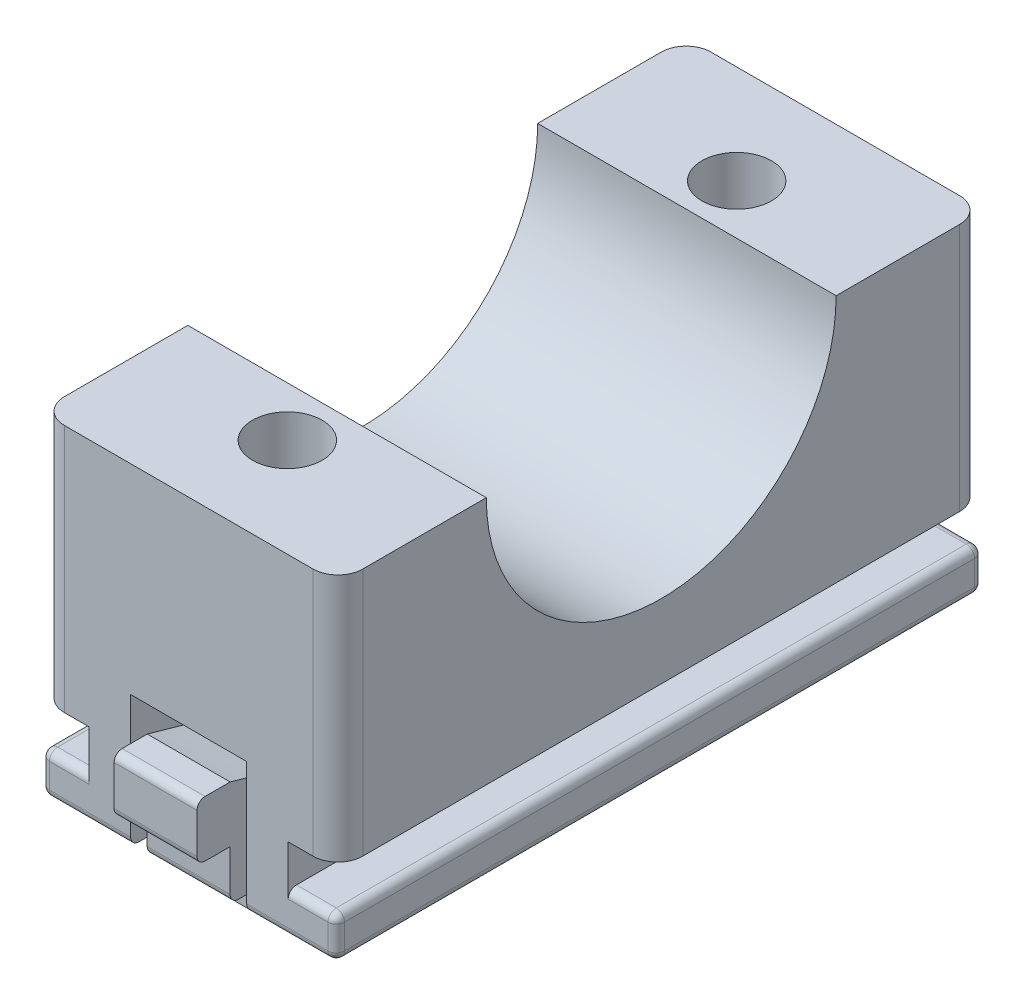
from build123d import *

# Parameters (mm, degrees)
BOSS_EXTRUDE1_DEPTH             = 39
HANDLEBARHOLE_R                 = 10.55
CUT_EXTRUDE1_DEPTH              = 48.381430962
SKETCH3_R                       = 2.1
CUT_EXTRUDE2_DEPTH              = 14
BOSS_EXTRUDE2_DEPTH             = 2.5
BOSS_EXTRUDE2_DEPTH_BACK        = 2.5
FILLET1_R                       = 0.5
CUT_EXTRUDE_THIN2_START         = -3.5
CUT_EXTRUDE_THIN2_DEPTH         = 7
CUT_EXTRUDE5_REACH              = 49.381
SKETCH10_W                      = 1
SKETCH10_H                      = 25.953669743
BOSS_EXTRUDE3_REACH             = 46.744
BOSS_EXTRUDE3_DIRECTION_2_REACH = 46.744
FILLET5_R                       = 1.5


# Read off the part's stored shape, not the designer's step: Cut-Extrude-Thin2
with BuildPart() as part:
    # Sketch1 → Boss-Extrude1 (new body)
    with BuildSketch(Plane.XY):
        Polygon((0, 5), (0, 20), (18, 20), (18, 5), (15, 5), (15, 2.5), (17.9, 2.5), (17.9, 0), (0.1, 0), (0.1, 2.5), (3, 2.5), (3, 5), align=None)
    extrude(amount=BOSS_EXTRUDE1_DEPTH)

    # HandlebarHole → Cut-Extrude1 (cut, through all)
    with BuildSketch(Plane(origin=(0, 0, 0), x_dir=(0, 0, -1), z_dir=(1, 0, 0))):
        with Locations((-19.5, 20)):
            Circle(HANDLEBARHOLE_R)
    extrude(amount=CUT_EXTRUDE1_DEPTH, mode=Mode.SUBTRACT)

    # Sketch3 → Cut-Extrude2 (cut)
    with BuildSketch(Plane(origin=(0, 20, 0), x_dir=(1, 0, 0), z_dir=(0, 1, 0))):
        with Locations(Location((9, -5.95, 0), (0, 0, 270))):
            Circle(SKETCH3_R)
        with Locations(Location((9, -33.05, 0), (0, 0, 270))):
            Circle(SKETCH3_R)
    extrude(amount=-CUT_EXTRUDE2_DEPTH, mode=Mode.SUBTRACT)

    # Sketch4 → Boss-Extrude2 (add, two sides: drawn at the far end of the back side and taken through both)
    with BuildSketch(Plane.ZY.offset(-9).offset(-BOSS_EXTRUDE2_DEPTH_BACK)):
        Polygon((33.5, 0), (37.5, 0), (37.5, -1.2), align=None)
    extrude(amount=BOSS_EXTRUDE2_DEPTH + BOSS_EXTRUDE2_DEPTH_BACK)

    # Fillet1
    fillet1_edges = [part.edges().sort_by_distance(p)[0] for p in [
        (17.9, 1.25, 39),
        (1.55, 2.5, 0),
        (16.45, 2.5, 39),
        (16.45, 2.5, 0),
        (17.9, 1.25, 0),
        (9, 0, 0),
        (0.1, 1.25, 0),
        (0.1, 2.5, 19.5),
        (17.9, 2.5, 19.5),
        (17.9, 0, 19.5),
        (0.1, 0, 19.5),
        (1.55, 2.5, 39),
        (0.1, 1.25, 39),
        (9, 0, 39),
    ]]
    fillet(fillet1_edges, radius=FILLET1_R)

    # Cut-Extrude-Thin2 outline → Cut-Extrude-Thin2 (cut)
    with BuildSketch(Plane.ZY.offset(-9).offset(CUT_EXTRUDE_THIN2_START)):
        with BuildLine():
            add(Edge.make_bspline(
                [(39, 6.377827527), (26.271218228, 2.589898365), (13, 3)],
                knots=[0.07295309, 0.07295309, 0.07295309, 1, 1, 1], degree=2))
            Line((39, 6.377827527), (39.000000003, 7.944068421))
            add(Edge.make_bspline(
                [(39.000000003, 7.944068421), (36.434479895, 7.165477311), (33.853278683, 6.517493693), (31.255701113, 6)],
                knots=[0.057086213, 0.057086213, 0.057086213, 0.057086213, 0.342626571, 0.342626571, 0.342626571, 0.342626571], degree=3))
            add(Edge.make_bspline(
                [(31.255701113, 6), (25.275536046, 4.808621641), (19.208573603, 4.308861265), (13.046330257, 4.499284332)],
                knots=[0.342626571, 0.342626571, 0.342626571, 0.342626571, 1, 1, 1, 1], degree=3))
            Line((13.046330257, 4.499284332), (13, 3))
        make_face()
    extrude(amount=CUT_EXTRUDE_THIN2_DEPTH, mode=Mode.SUBTRACT)

    # Sketch10 → Cut-Extrude5 (cut, up to next)
    with BuildSketch(Plane(origin=(0, 0, 0), x_dir=(1, 0, 0), z_dir=(0, 1, 0)), mode=Mode.PRIVATE) as cut_extrude5_sk1:
        with Locations((12, -26.023165129)):
            Rectangle(SKETCH10_W, SKETCH10_H)
    cut_extrude5_tool1 = extrude(cut_extrude5_sk1.sketch, amount=CUT_EXTRUDE5_REACH, mode=Mode.PRIVATE) & part.part
    # Sketch10 → Cut-Extrude5 (cut, up to next)
    with BuildSketch(Plane(origin=(0, 0, 0), x_dir=(1, 0, 0), z_dir=(0, 1, 0)), mode=Mode.PRIVATE) as cut_extrude5_sk2:
        with Locations((6, -26.023165129)):
            Rectangle(SKETCH10_W, SKETCH10_H)
    cut_extrude5_tool2 = extrude(cut_extrude5_sk2.sketch, amount=CUT_EXTRUDE5_REACH, mode=Mode.PRIVATE) & part.part
    add(cut_extrude5_tool1.solids().sort_by_distance((12, 0, 26.023165))[0], mode=Mode.SUBTRACT)
    add(cut_extrude5_tool2.solids().sort_by_distance((6, 0, 26.023165))[0], mode=Mode.SUBTRACT)

    # Boss-Extrude3: up to this face of the body (flat: up to its plane)
    boss_extrude3_end = Plane(part.part.faces().sort_by_distance((6.5, 2.064317156, 28.033592375))[0])
    # Sketch11 → Boss-Extrude3 (add, up to the picked face)
    with BuildSketch(Plane.ZY.offset(-9), mode=Mode.PRIVATE) as boss_extrude3_sk1:
        with BuildLine():
            Line((39, 3), (40.51, 3))
            ThreePointArc((40.51, 3), (40.856482323, 3.143517677), (41, 3.49))
            Line((41, 3.49), (41, 5.887827527))
            ThreePointArc((41, 5.887827527), (40.856482323, 6.23430985), (40.51, 6.377827527))
            Line((40.51, 6.377827527), (39, 6.377827527))
            Line((39, 6.377827527), (39, 3))
        make_face()
    boss_extrude3_tool1 = split(extrude(boss_extrude3_sk1.sketch, amount=BOSS_EXTRUDE3_REACH, mode=Mode.PRIVATE), bisect_by=boss_extrude3_end, keep=Keep.BOTH, mode=Mode.PRIVATE)
    add(boss_extrude3_tool1.solids().sort_by(Axis((9, 4.688914, 39.986205), (-1, 0, 0)))[0])

    # Boss-Extrude3 direction 2: up to this face of the body (flat: up to its plane)
    boss_extrude3_direction_2_end = Plane(part.part.faces().sort_by_distance((11.5, 2.064317156, 28.033592375))[0])
    # Sketch11 → Boss-Extrude3 direction 2 (add, up to the picked face)
    with BuildSketch(Plane.ZY.offset(-9), mode=Mode.PRIVATE) as boss_extrude3_direction_2_sk1:
        with BuildLine():
            Line((39, 3), (40.51, 3))
            ThreePointArc((40.51, 3), (40.856482323, 3.143517677), (41, 3.49))
            Line((41, 3.49), (41, 5.887827527))
            ThreePointArc((41, 5.887827527), (40.856482323, 6.23430985), (40.51, 6.377827527))
            Line((40.51, 6.377827527), (39, 6.377827527))
            Line((39, 6.377827527), (39, 3))
        make_face()
    boss_extrude3_direction_2_tool1 = split(extrude(boss_extrude3_direction_2_sk1.sketch, amount=-BOSS_EXTRUDE3_DIRECTION_2_REACH, mode=Mode.PRIVATE), bisect_by=boss_extrude3_direction_2_end, keep=Keep.BOTH, mode=Mode.PRIVATE)
    add(boss_extrude3_direction_2_tool1.solids().sort_by(Axis((9, 4.688914, 39.986205), (1, 0, 0)))[0])

    # Fillet5
    fillet5_edges = [part.edges().sort_by_distance(p)[0] for p in [
        (0, 12.5, 0),
        (18, 12.5, 0),
        (18, 12.5, 39),
        (0, 12.5, 39),
    ]]
    fillet(fillet5_edges, radius=FILLET5_R)


solid = part.part
